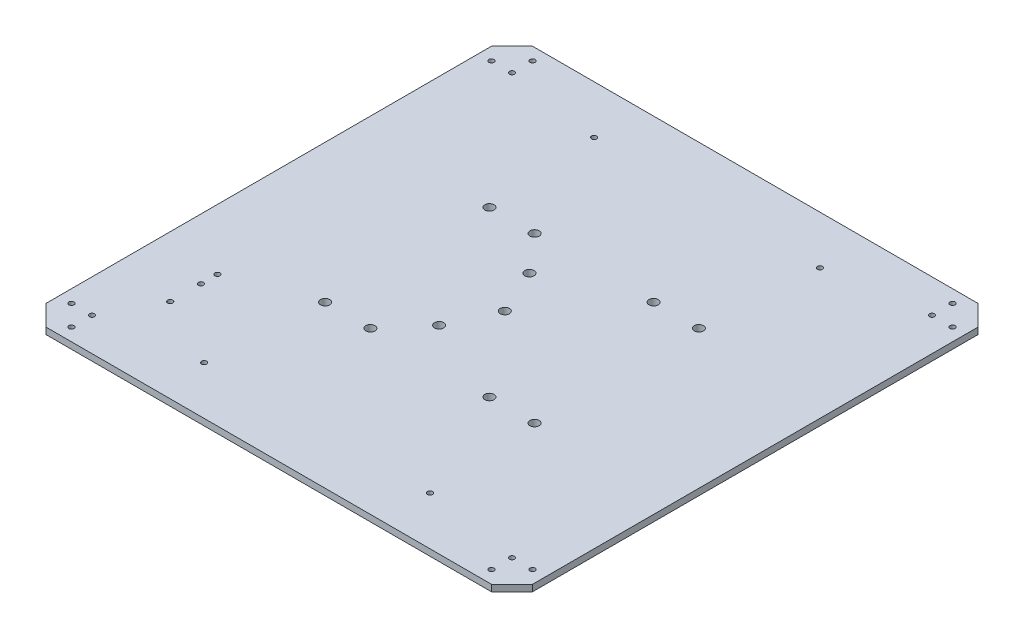
from build123d import *

# Parameters (mm, degrees)
BOSS_EXTRUDE1_DEPTH      = 3.175
SKETCH2_R                = 1.5
SKETCH2_R_2              = 2.25
CUT_EXTRUDE1_DEPTH       = 168.614380723
M3X0_5_TAPPED_HOLE1_D    = 2.5
SKETCH5_R                = 1.25
CUT_EXTRUDE2_DEPTH       = 168.614380723
SKETCH6_R                = 1.25
CUT_EXTRUDE3_DEPTH       = 10
M4_CLEARANCE_HOLE1_D     = 4.5
M4_CLEARANCE_HOLE1_DEPTH = 10
M4_CLEARANCE_HOLE1_TIP   = 1.351936393


with BuildPart() as part:
    # Sketch1 → Boss-Extrude1 (new body)
    with BuildSketch(Plane(origin=(0, 0, 0), x_dir=(1, 0, 0), z_dir=(0, 1, 0))):
        Polygon((-108.5, 118.5), (108.5, 118.5), (118.5, 108.5), (118.5, -108.5), (108.5, -118.5), (-108.5, -118.5), (-118.5, -108.5), (-118.5, 108.5), align=None)
    extrude(amount=BOSS_EXTRUDE1_DEPTH)

    # Sketch2 → Cut-Extrude1 (cut, through all)
    with BuildSketch(Plane(origin=(0, 3.175, 0), x_dir=(1, 0, 0), z_dir=(0, 1, 0))):
        with Locations((-51, -40)):
            Circle(SKETCH2_R)
        with Locations((-29, -40)):
            Circle(SKETCH2_R_2)
        with Locations((-51, 40)):
            Circle(SKETCH2_R)
        with Locations((-29, 40)):
            Circle(SKETCH2_R_2)
        with Locations((29, 40)):
            Circle(SKETCH2_R_2)
        with Locations((51, 40)):
            Circle(SKETCH2_R_2)
        with Locations((29, -40)):
            Circle(SKETCH2_R_2)
        with Locations((51, -40)):
            Circle(SKETCH2_R_2)
        with Locations((-3.5, 0)):
            Circle(SKETCH2_R_2)
        with Locations((-13.5, 22)):
            Circle(SKETCH2_R_2)
        with Locations((-13.5, -22)):
            Circle(SKETCH2_R_2)
    extrude(amount=-CUT_EXTRUDE1_DEPTH, mode=Mode.SUBTRACT)

    # M3x0.5 Tapped Hole1 (through all)
    with Locations(Plane(origin=(0, 3.175, 0), x_dir=(-1, 0, 0), z_dir=(0, 1, 0))):
        with Locations((112.3, -102.3), (102.3, -112.3), (-102.3, -112.3), (-112.3, -102.3), (-112.3, 102.3), (-102.3, 112.3), (102.3, 112.3), (112.3, 102.3), (-102.3, 102.3), (-102.3, -102.3), (102.3, -102.3), (102.3, 102.3)):
            Hole(M3X0_5_TAPPED_HOLE1_D / 2)

    # Sketch5 → Cut-Extrude2 (cut, through all)
    with BuildSketch(Plane(origin=(0, 3.175, 0), x_dir=(1, 0, 0), z_dir=(0, 1, 0))):
        with Locations((-55, 95)):
            Circle(SKETCH5_R)
        with Locations((55, 95)):
            Circle(SKETCH5_R)
        with Locations((-55, -95)):
            Circle(SKETCH5_R)
        with Locations((55, -95)):
            Circle(SKETCH5_R)
    extrude(amount=-CUT_EXTRUDE2_DEPTH, mode=Mode.SUBTRACT)

    # Sketch6 → Cut-Extrude3 (cut)
    with BuildSketch(Plane(origin=(0, 3.175, 0), x_dir=(1, 0, 0), z_dir=(0, 1, 0))):
        with Locations((-89, -62.5)):
            Circle(SKETCH6_R)
        with Locations((-89, -54.5)):
            Circle(SKETCH6_R)
        with Locations((-89, -77.5)):
            Circle(SKETCH6_R)
    extrude(amount=-CUT_EXTRUDE3_DEPTH, mode=Mode.SUBTRACT)

    # M4 Clearance Hole1
    with Locations(Plane(origin=(0, 3.175, 0), x_dir=(-1, 0, 0), z_dir=(0, 1, 0))):
        with Locations((51, -40), (51, 40)):
            Hole(M4_CLEARANCE_HOLE1_D / 2, depth=M4_CLEARANCE_HOLE1_DEPTH)
            with Locations((0, 0, -(M4_CLEARANCE_HOLE1_DEPTH + M4_CLEARANCE_HOLE1_TIP / 2))):  # 118° drill point
                Cone(0, M4_CLEARANCE_HOLE1_D / 2, M4_CLEARANCE_HOLE1_TIP, mode=Mode.SUBTRACT)


solid = part.part
